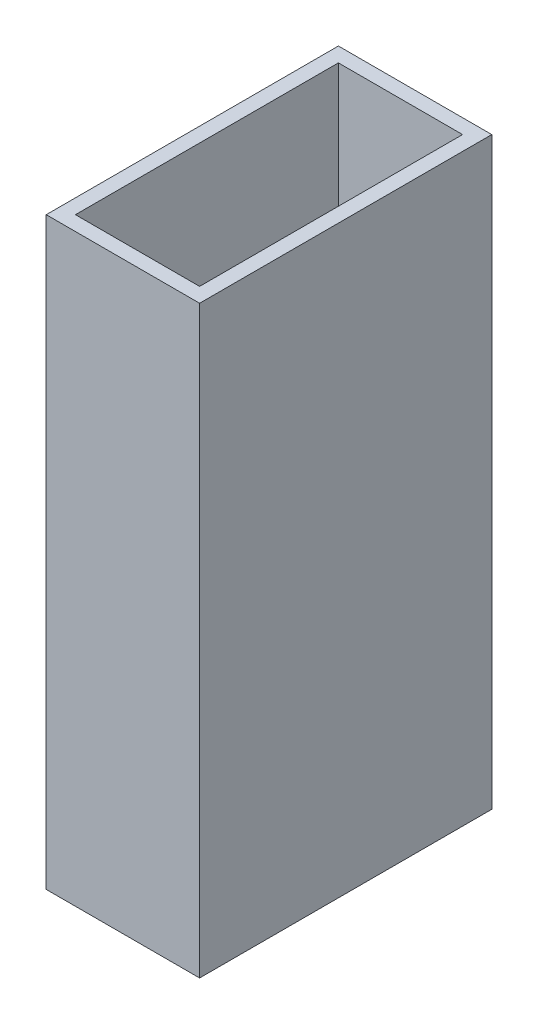
from build123d import *

# Parameters (mm, degrees)
SKETCH1_W           = 52.5
SKETCH1_H           = 100
BOSS_EXTRUDE1_DEPTH = 200
SHELL2_T            = -5


with BuildPart() as part:
    # Sketch1 → Boss-Extrude1 (new body)
    with BuildSketch(Plane(origin=(0, 0, 0), x_dir=(1, 0, 0), z_dir=(0, 1, 0))):
        Rectangle(SKETCH1_W, SKETCH1_H)
    extrude(amount=BOSS_EXTRUDE1_DEPTH)

    # Shell2
    shell2_openings = [part.faces().sort_by_distance(p)[0] for p in [
        (0, 200, 0),
    ]]
    offset(amount=SHELL2_T, openings=shell2_openings, kind=Kind.INTERSECTION)


solid = part.part
